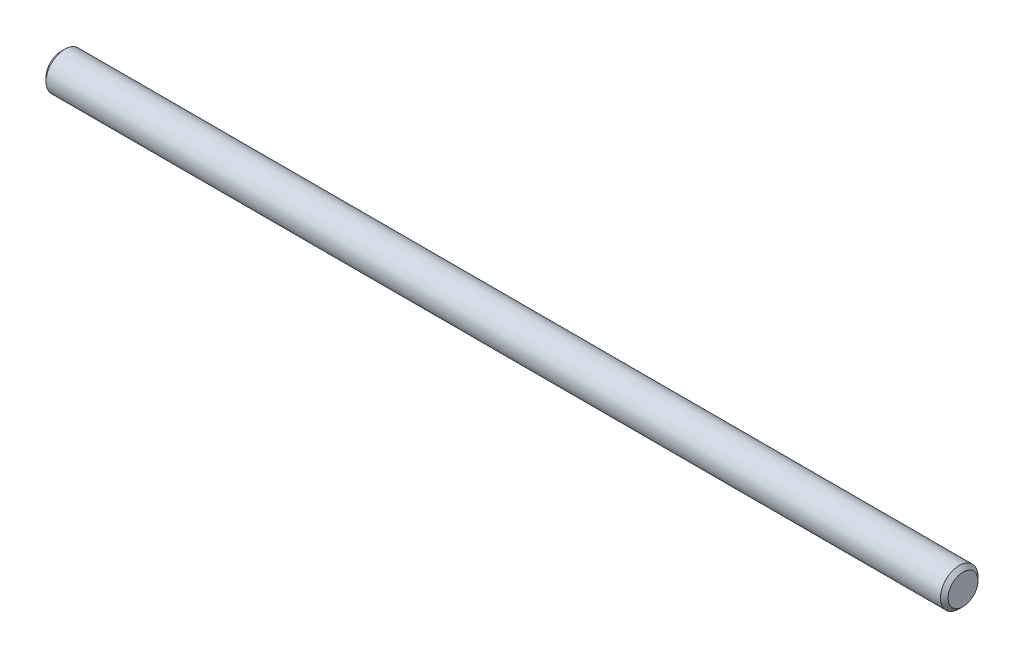
from build123d import *

# Parameters (mm, degrees)
SKETCH1_R           = 4
BOSS_EXTRUDE1_DEPTH = 96
CHAMFER1_SIZE       = 0.81


with BuildPart() as part:
    # Sketch1 → Boss-Extrude1 (new, symmetric)
    with BuildSketch(Plane(origin=(0, 0, 0), x_dir=(0, 0, -1), z_dir=(1, 0, 0))):
        Circle(SKETCH1_R)
    extrude(amount=BOSS_EXTRUDE1_DEPTH, both=True)

    # Chamfer1
    chamfer1_edges = [part.edges().sort_by_distance(p)[0] for p in [
        (96, 0, 4),
        (-96, 0, 4),
    ]]
    chamfer(chamfer1_edges, length=CHAMFER1_SIZE)


solid = part.part
